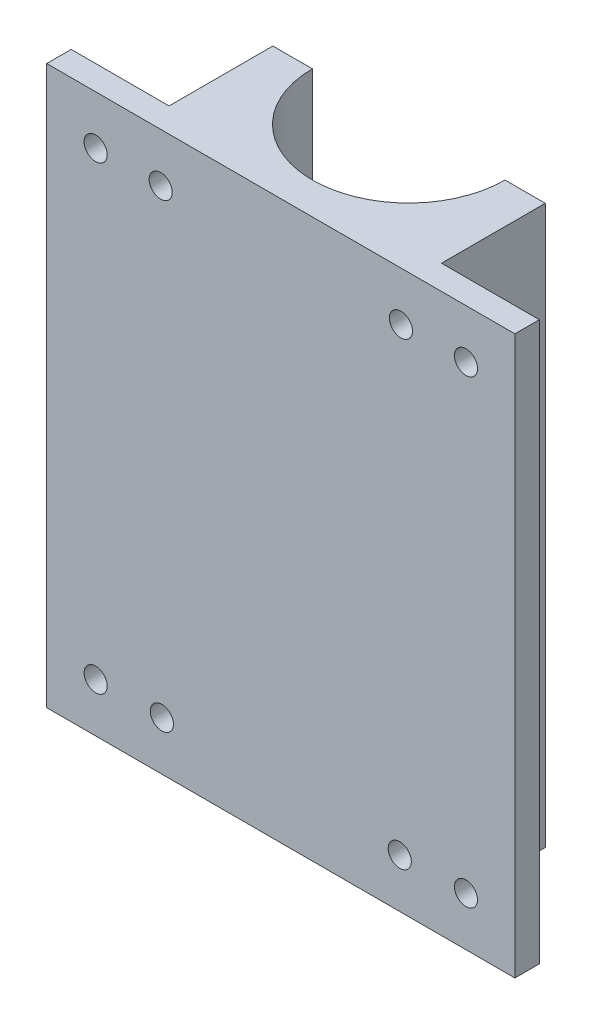
from build123d import *

# Parameters (mm, degrees)
BOSS_EXTRUDE3_DEPTH   = 72.39
BOSS_EXTRUDE4_DEPTH   = 51.39
F_3_0MM_DOWEL_HOLE1_D = 3
F_3_0MM_DOWEL_HOLE2_D = 3
F_3_0MM_DOWEL_HOLE4_D = 3


with BuildPart() as part:
    # Sketch1 → Boss-Extrude3 (new body)
    with BuildSketch(Plane(origin=(0, 0, 0), x_dir=(1, 0, 0), z_dir=(0, 1, 0))):
        with BuildLine():
            Line((-11.1466884, 17.698170271), (-23.8485284, 17.698170271))
            Line((-23.8485284, 17.698170271), (-23.8485284, 14.523170271))
            Line((-23.8485284, 14.523170271), (36.9033116, 14.523170271))
            Line((36.9033116, 14.523170271), (36.9033116, 17.698170271))
            Line((36.9033116, 17.698170271), (24.2033116, 17.698170271))
            Line((24.2033116, 17.698170271), (24.2033116, 31.16592192))
            Line((24.2033116, 31.16592192), (18.979662229, 31.16592192))
            ThreePointArc((18.979662229, 31.16592192), (6.479662229, 18.665921919), (-6.020337771, 31.16592192))
            Line((-6.020337771, 31.16592192), (-11.1466884, 31.16592192))
            Line((-11.1466884, 31.16592192), (-11.1466884, 17.698170271))
        make_face()
    extrude(amount=BOSS_EXTRUDE3_DEPTH)

    # Sketch1<13> → Boss-Extrude4 (add)
    with BuildSketch(Plane(origin=(0, 0, 0), x_dir=(1, 0, 0), z_dir=(0, 1, 0))):
        with BuildLine():
            Line((-6.020337771, 31.16592192), (-5.720337771, 31.16592192))
            ThreePointArc((-5.720337771, 31.16592192), (6.479662229, 18.965921919), (18.679662229, 31.16592192))
            Line((18.679662229, 31.16592192), (18.979662229, 31.16592192))
            ThreePointArc((18.979662229, 31.16592192), (6.479662229, 18.665921919), (-6.020337771, 31.16592192))
        make_face()
    extrude(amount=BOSS_EXTRUDE4_DEPTH)

    # Ø3.0mm Dowel Hole1 (through all)
    with Locations(Plane(origin=(0, 0, -17.698170271), x_dir=(-1, 0, 0), z_dir=(0, 0, -1))):
        with Locations((-30.5533116, 66.04), (-30.5533116, 6.35)):
            Hole(F_3_0MM_DOWEL_HOLE1_D / 2)

    # Ø3.0mm Dowel Hole2 (through all)
    with Locations(Plane(origin=(0, 0, -17.698170271), x_dir=(-1, 0, 0), z_dir=(0, 0, -1))):
        with Locations((17.4985284, 6.35), (17.4985284, 66.04)):
            Hole(F_3_0MM_DOWEL_HOLE2_D / 2)

    # Ø3.0mm Dowel Hole4 (through all)
    with Locations(Plane(origin=(0, 0, -31.16592192), x_dir=(-1, 0, 0), z_dir=(0, 0, -1))):
        with Locations((-22.1133116, 66.04), (9.0566884, 66.04), (8.9066884, 6.35), (-21.9633116, 6.35)):
            Hole(F_3_0MM_DOWEL_HOLE4_D / 2)


solid = part.part
